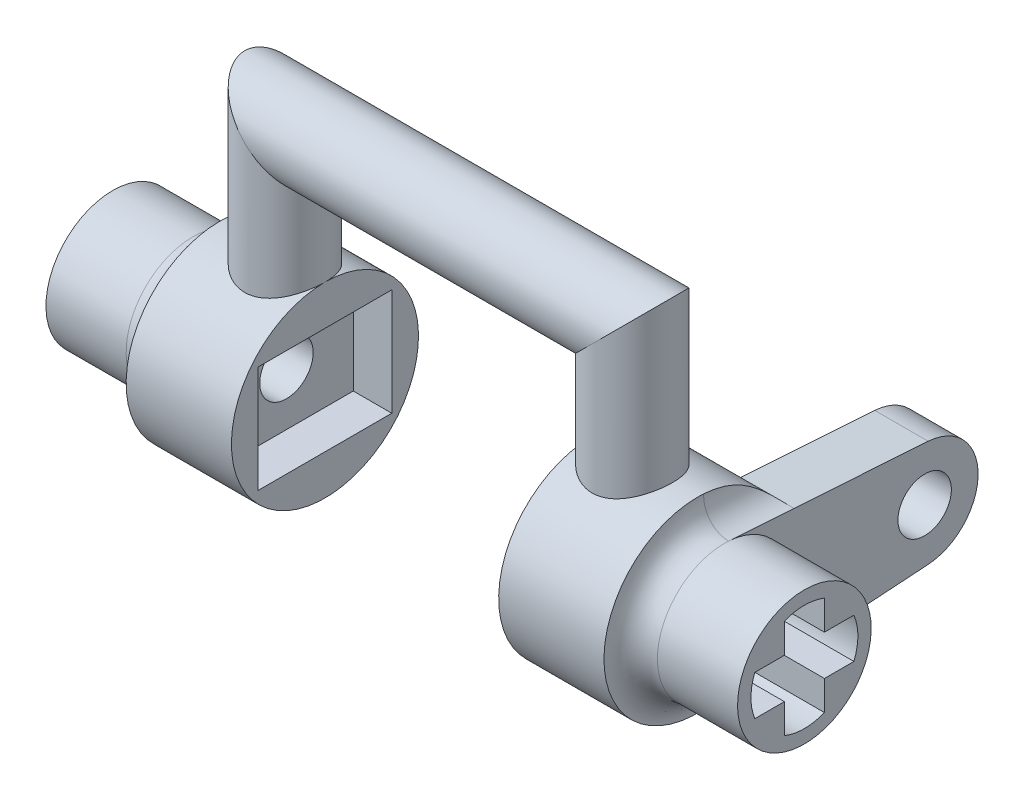
from build123d import *

# Parameters (mm, degrees)
SWEEP_1_PROFILE_R        = 1.5
EXTRUDE_1_DEPTH          = 3.44
EXTRUDE_1_DEPTH_BACK     = 4.5
EXTRUDE_1_START          = 9.5
SKETCH_8_R               = 2.5
EXTRUDE_2_DEPTH          = 4.5
EXTRUDE_2_DEPTH_BACK     = 3.44
EXTRUDE_2_START          = -9.5
SKETCH_9_R               = 2.5
EXTRUDE_START            = 9.94
SKETCH_14_R              = 1
EXTRUDE_3_DEPTH          = 2
CUT_EXTRUDE_START        = 12.94
CUT_EXTRUDE_1_DEPTH      = 4
CUT_EXTRUDE_START_2      = -8.94
CUT_EXTRUDE_2_DEPTH      = 4
SKETCH_16_R              = 0.25
CUT_EXTRUDE_3_DEPTH      = 0.25
CUT_EXTRUDE_START_3      = 8.69
SKETCH_17_R              = 0.25
CUT_EXTRUDE_4_DEPTH      = 0.25
EXTRUDE_START_2          = 5
SKETCH_18_R              = 3.5
EXTRUDE_4_DEPTH          = 3.94
EXTRUDE_START_3          = -8.94
SKETCH_20_R              = 3.5
EXTRUDE_5_DEPTH          = 3.94
CUT_EXTRUDE_5_DEPTH      = 2
CUT_EXTRUDE_5_DEPTH_BACK = 2
SKETCH_22_W              = 1.44
SKETCH_22_H              = 5
CUT_EXTRUDE_6_DEPTH      = 19.653246417
CUT_EXTRUDE_6_DEPTH_BACK = 19.653246417
SKETCH_25_R              = 1
FILLET_1_R               = 1


with BuildPart() as part:
    # 扫描1: sweep along a path in 草图1
    with BuildLine(Plane.XY) as sweep_1_path:
        Line((9.5, 0), (6.5, 0))
        Line((6.5, 0), (6.5, 8))
        Line((6.5, 8), (-6.5, 8))
        Line((-6.5, 8), (-6.5, 0))
        Line((-6.5, 0), (-9.5, 0))
    # 扫描1 profile (on start of the path) → 扫描1 (sweep)
    with BuildSketch(Plane(origin=(9.5, 0, 0), x_dir=(0, -1, 0), z_dir=(-1, 0, 0))):
        Circle(SWEEP_1_PROFILE_R)
    sweep(path=sweep_1_path.line, transition=Transition.RIGHT)

    # 草图8 → 凸台-拉伸1 (add, two sides: drawn at the far end of the back side and taken through both)
    with BuildSketch(Plane(origin=(0, 0, 0), x_dir=(0, 0, -1), z_dir=(1, 0, 0)).offset(EXTRUDE_1_START - EXTRUDE_1_DEPTH_BACK)):
        with Locations(Location((0, 0, 0), (0, 0, 90))):
            Circle(SKETCH_8_R)
    extrude(amount=EXTRUDE_1_DEPTH + EXTRUDE_1_DEPTH_BACK)

    # 草图9 → 凸台-拉伸2 (add, two sides: drawn at the far end of the back side and taken through both)
    with BuildSketch(Plane(origin=(0, 0, 0), x_dir=(0, 0, -1), z_dir=(1, 0, 0)).offset(EXTRUDE_2_START - EXTRUDE_2_DEPTH_BACK)):
        with Locations(Location((0, 0, 0), (0, 0, 90))):
            Circle(SKETCH_9_R)
    extrude(amount=EXTRUDE_2_DEPTH + EXTRUDE_2_DEPTH_BACK)

    # 草图14 → 凸台-拉伸3 (add)
    with BuildSketch(Plane(origin=(0, 0, 0), x_dir=(0, 0, -1), z_dir=(1, 0, 0)).offset(EXTRUDE_START)):
        with BuildLine():
            Line((0.166666667, 2.494438258), (7.633333333, 1.995550606))
            ThreePointArc((7.633333333, 1.995550606), (9.5, 0), (7.633333333, -1.995550606))
            Line((7.633333333, -1.995550606), (0.166666667, -2.494438258))
            ThreePointArc((0.166666667, -2.494438258), (-2.5, 0), (0.166666667, 2.494438258))
        make_face()
        with Locations((7.5, 0)):
            Circle(SKETCH_14_R, mode=Mode.SUBTRACT)
    extrude(amount=-EXTRUDE_3_DEPTH)

    # 草图10 → 切除-拉伸1 (cut)
    with BuildSketch(Plane(origin=(0, 0, 0), x_dir=(0, 0, -1), z_dir=(1, 0, 0)).offset(CUT_EXTRUDE_START)):
        with BuildLine():
            Line((0.75, 0.75), (1.854049622, 0.75))
            ThreePointArc((1.854049622, 0.75), (2, 0), (1.854049622, -0.75))
            Line((1.854049622, -0.75), (0.75, -0.75))
            Line((0.75, -0.75), (0.75, -1.854049622))
            ThreePointArc((0.75, -1.854049622), (0, -2), (-0.75, -1.854049622))
            Line((-0.75, -1.854049622), (-0.75, -0.75))
            Line((-0.75, -0.75), (-1.854049622, -0.75))
            ThreePointArc((-1.854049622, -0.75), (-2, 0), (-1.854049622, 0.75))
            Line((-1.854049622, 0.75), (-0.75, 0.75))
            Line((-0.75, 0.75), (-0.75, 1.854049622))
            ThreePointArc((-0.75, 1.854049622), (0, 2), (0.75, 1.854049622))
            Line((0.75, 1.854049622), (0.75, 0.75))
        make_face()
    extrude(amount=-CUT_EXTRUDE_1_DEPTH, mode=Mode.SUBTRACT)

    # 草图11 → 切除-拉伸2 (cut)
    with BuildSketch(Plane(origin=(0, 0, 0), x_dir=(0, 0, -1), z_dir=(1, 0, 0)).offset(CUT_EXTRUDE_START_2)):
        with BuildLine():
            Line((0.75, 0.75), (0.75, 1.854049622))
            ThreePointArc((0.75, 1.854049622), (0, 2), (-0.75, 1.854049622))
            Line((-0.75, 1.854049622), (-0.75, 0.75))
            Line((-0.75, 0.75), (-1.854049622, 0.75))
            ThreePointArc((-1.854049622, 0.75), (-2, 0), (-1.854049622, -0.75))
            Line((-1.854049622, -0.75), (-0.75, -0.75))
            Line((-0.75, -0.75), (-0.75, -1.854049622))
            ThreePointArc((-0.75, -1.854049622), (0, -2), (0.75, -1.854049622))
            Line((0.75, -1.854049622), (0.75, -0.75))
            Line((0.75, -0.75), (1.854049622, -0.75))
            ThreePointArc((1.854049622, -0.75), (2, 0), (1.854049622, 0.75))
            Line((1.854049622, 0.75), (0.75, 0.75))
        make_face()
    extrude(amount=-CUT_EXTRUDE_2_DEPTH, mode=Mode.SUBTRACT)

    # 草图16 → 切除-拉伸3 (cut)
    with BuildSketch(Plane(origin=(0, 0, 0), x_dir=(0, 0, -1), z_dir=(1, 0, 0)).offset(CUT_EXTRUDE_START_2)):
        with Locations(Location((0.75, 0, 0), (0, 0, 90))):
            Circle(SKETCH_16_R)
    extrude(amount=CUT_EXTRUDE_3_DEPTH, mode=Mode.SUBTRACT)

    # 草图17 → 切除-拉伸4 (cut)
    with BuildSketch(Plane(origin=(0, 0, 0), x_dir=(0, 0, -1), z_dir=(1, 0, 0)).offset(CUT_EXTRUDE_START_3)):
        with Locations(Location((0.75, 0, 0), (0, 0, 90))):
            Circle(SKETCH_17_R)
    extrude(amount=CUT_EXTRUDE_4_DEPTH, mode=Mode.SUBTRACT)

    # 草图18 → 凸台-拉伸4 (add)
    with BuildSketch(Plane(origin=(0, 0, 0), x_dir=(0, 0, -1), z_dir=(1, 0, 0)).offset(EXTRUDE_START_2)):
        with Locations(Location((0, 0, 0), (0, 0, 90))):
            Circle(SKETCH_18_R)
    extrude(amount=EXTRUDE_4_DEPTH)

    # 草图20 → 凸台-拉伸5 (add)
    with BuildSketch(Plane(origin=(0, 0, 0), x_dir=(0, 0, -1), z_dir=(1, 0, 0)).offset(EXTRUDE_START_3)):
        with Locations(Location((0, 0, 0), (0, 0, 90))):
            Circle(SKETCH_20_R)
    extrude(amount=EXTRUDE_5_DEPTH)

    # 草图22 → 切除-拉伸5 (cut, two sides: drawn at the far end of the back side and taken through both)
    with BuildSketch(Plane(origin=(0, 0, 0), x_dir=(1, 0, 0), z_dir=(0, 1, 0)).offset(-CUT_EXTRUDE_5_DEPTH_BACK)):
        with Locations((-5.72, 0)):
            Rectangle(SKETCH_22_W, SKETCH_22_H)
        with Locations((5.72, 0)):
            Rectangle(SKETCH_22_W, SKETCH_22_H)
    extrude(amount=CUT_EXTRUDE_5_DEPTH + CUT_EXTRUDE_5_DEPTH_BACK, mode=Mode.SUBTRACT)

    # 草图25 → 切除-拉伸6 (cut, two sides: drawn at the far end of the back side and taken through both)
    with BuildSketch(Plane(origin=(0, 0, 0), x_dir=(0, 0, -1), z_dir=(1, 0, 0)).offset(-CUT_EXTRUDE_6_DEPTH_BACK)):
        Circle(SKETCH_25_R)
    extrude(amount=CUT_EXTRUDE_6_DEPTH + CUT_EXTRUDE_6_DEPTH_BACK, mode=Mode.SUBTRACT)

    # 圆角1
    # the kernel refuses this fillet: 1 mm, written as the material it adds along each edge
    with BuildSketch(Plane(origin=(-8.94, 0, 0), x_dir=(0, 1, 0), z_dir=(0, 0, 1))) as fillet_1_piece_1:
        with BuildLine():
            CenterArc((2.5 + FILLET_1_R, FILLET_1_R), FILLET_1_R, 180, 90)
            Line((2.5, FILLET_1_R), (2.5, 0))
            Line((2.5, 0), (2.5 + FILLET_1_R, 0))
        make_face()
    revolve(axis=Axis((-8.94, 0, 0), (-1, 0, 0)))
    with BuildSketch(Plane(origin=(8.94, 0, 0), x_dir=(0, 1, 0), z_dir=(0, 0, -1))) as fillet_1_piece_2:
        with BuildLine():
            CenterArc((2.5 + FILLET_1_R, FILLET_1_R), FILLET_1_R, 180, 90)
            Line((2.5 + FILLET_1_R, 0), (2.5, 0))
            Line((2.5, 0), (2.5, FILLET_1_R))
        make_face()
    revolve(axis=Axis((8.94, 0, 0), (1, 0, 0)), revolution_arc=183.822553729)
    with BuildSketch(Plane(origin=(8.94, -2.494438258, -0.166666667), x_dir=(1, 0, 0), z_dir=(0, 0.06666666666666658, -0.9977753031397177))) as fillet_1_piece_3_section:
        with BuildLine():
            CenterArc((FILLET_1_R, FILLET_1_R), FILLET_1_R, 180, 90)
            Line((0, FILLET_1_R), (0, 0))
            Line((0, 0), (FILLET_1_R, 0))
        make_face()
    fillet_1_piece_3 = extrude(amount=4.949489743, mode=Mode.PRIVATE)
    fillet_1_piece_3 = fillet_1_piece_3 & Plane(origin=(9.184299624, 0, 0), x_dir=(0, 1, 0), z_dir=(-1, 0, 0)) * Cylinder(3.5, 14, mode=Mode.PRIVATE)
    add(fillet_1_piece_3)
    with BuildSketch(Plane(origin=(8.94, 2.164472275, -5.105145295), x_dir=(0, 0.9977753031397177, -0.0666666666666666), z_dir=(0, 0.06666666666666658, 0.9977753031397177))) as fillet_1_piece_4_section:
        with BuildLine():
            CenterArc((FILLET_1_R, -FILLET_1_R), FILLET_1_R, 90, 90)
            Line((0, -FILLET_1_R), (0, 0))
            Line((0, 0), (FILLET_1_R, 0))
        make_face()
    fillet_1_piece_4 = extrude(amount=4.949489743, mode=Mode.PRIVATE)
    fillet_1_piece_4 = fillet_1_piece_4 & Plane(origin=(9.184299625, 0, 0), x_dir=(0, 1, 0), z_dir=(-1, 0, 0)) * Cylinder(3.5, 14, mode=Mode.PRIVATE)
    add(fillet_1_piece_4)
    with BuildSketch(Plane(origin=(8.94, 0, 0), x_dir=(0, 0.9977753030864385, -0.06666666746407793), z_dir=(0, -0.06666666746407793, -0.9977753030864385))) as fillet_1_piece_5:
        with BuildLine():
            CenterArc((2.5 + FILLET_1_R, FILLET_1_R), FILLET_1_R, 180, 90)
            Line((2.5, FILLET_1_R), (2.5, 0))
            Line((2.5, 0), (2.5 + FILLET_1_R, 0))
        make_face()
    revolve(axis=Axis((8.94, 0, 0), (1, 0, 0)), revolution_arc=3.822553775)


solid = part.part
